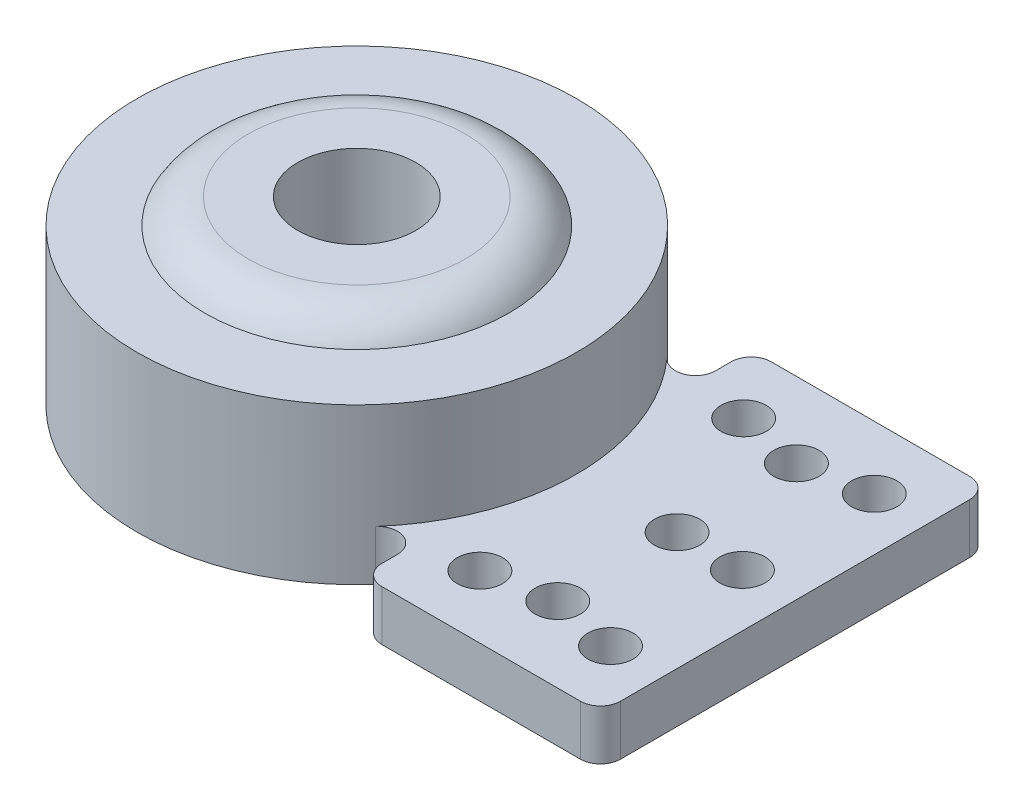
from build123d import *

# Parameters (mm, degrees)
SKETCH1_R           = 8.75
BOSS_EXTRUDE1_DEPTH = 6.2
BOSS_EXTRUDE2_DEPTH = 2
FILLET1_R           = 0.8
SKETCH3_R           = 4.75
BOSS_EXTRUDE3_DEPTH = 1.3
SKETCH6_R           = 6.05
BOSS_EXTRUDE5_DEPTH = 1
SKETCH4_R           = 2.35
CUT_EXTRUDE2_DEPTH  = 22.291195363
FILLET2_R           = 2
SKETCH7_R           = 0.9
CUT_EXTRUDE4_DEPTH  = 10


with BuildPart() as part:
    # Sketch1 → Boss-Extrude1 (new body)
    with BuildSketch(Plane(origin=(0, 0, 0), x_dir=(1, 0, 0), z_dir=(0, 1, 0))):
        with Locations(Location((0, 0, 0), (0, 0, 90))):
            Circle(SKETCH1_R)
    extrude(amount=BOSS_EXTRUDE1_DEPTH)

    # Sketch2 → Boss-Extrude2 (add)
    with BuildSketch(Plane.XZ):
        with BuildLine():
            ThreePointArc((7.95, 3.655133376), (8.547660499, 1.870828693), (8.75, 0))
            Line((8.75, 0), (17.45, 0))
            Line((17.45, 0), (17.45, 7.75))
            Line((17.45, 7.75), (7.95, 7.75))
            Line((7.95, 7.75), (7.95, 3.655133376))
        make_face()
        with BuildLine():
            Line((17.45, 0), (8.75, 0))
            ThreePointArc((8.75, 0), (8.547660499, -1.870828693), (7.95, -3.655133376))
            Line((7.95, -3.655133376), (7.95, -7.75))
            Line((7.95, -7.75), (17.45, -7.75))
            Line((17.45, -7.75), (17.45, 0))
        make_face()
    extrude(amount=-BOSS_EXTRUDE2_DEPTH)

    # Fillet1
    fillet1_edges = [part.edges().sort_by_distance(p)[0] for p in [
        (7.95, 1, 3.655133376),
        (7.95, 1, 7.75),
        (17.45, 1, 7.75),
        (17.45, 1, -7.75),
        (7.95, 1, -7.75),
        (7.95, 1, -3.655133376),
    ]]
    fillet(fillet1_edges, radius=FILLET1_R)

    # Sketch3 → Boss-Extrude3 (add)
    with BuildSketch(Plane.XZ):
        with Locations(Location((0, 0, 0), (0, 0, 270))):
            Circle(SKETCH3_R)
    extrude(amount=BOSS_EXTRUDE3_DEPTH)

    # Sketch6 → Boss-Extrude5 (add)
    with BuildSketch(Plane(origin=(0, 6.2, 0), x_dir=(1, 0, 0), z_dir=(0, 1, 0))):
        with Locations(Location((0, 0, 0), (0, 0, 270))):
            Circle(SKETCH6_R)
    extrude(amount=BOSS_EXTRUDE5_DEPTH)

    # Sketch4 → Cut-Extrude2 (cut, through all)
    with BuildSketch(Plane.XZ.offset(1.3)):
        with Locations(Location((0, 0, 0), (0, 0, 270))):
            Circle(SKETCH4_R)
    extrude(amount=-CUT_EXTRUDE2_DEPTH, mode=Mode.SUBTRACT)

    # Fillet2
    # the kernel refuses this fillet: 2 mm, written as the material it takes off along each edge
    with BuildSketch(Plane(origin=(0, 7.2, 0), x_dir=(0, 0, 1), z_dir=(-1, 0, 0))) as fillet2_piece_1:
        with BuildLine():
            CenterArc((4.317949192, -2), FILLET2_R, 30, 60)
            Line((4.317949192, 0), (4.317949192, 0.04))
            Line((4.317949192, 0.04), (6.05, 0.04))
            Line((6.05, 0.04), (6.09, 0))
            ThreePointArc((6.09, 0), (6.09, -0.5), (6.084641016, -0.98))
            Line((6.084641016, -0.98), (6.05, -1))
        make_face()
    revolve(axis=Axis((0, 7.2, 0), (0, 1, 0)), mode=Mode.SUBTRACT)

    # Sketch7 → Cut-Extrude4 (cut)
    with BuildSketch(Plane.XZ):
        with Locations(Location((15.35, -5.25, 0), (0, 0, 270))):
            Circle(SKETCH7_R)
        with Locations(Location((10.15, -5.25, 0), (0, 0, 270))):
            Circle(SKETCH7_R)
        with Locations(Location((12.75, 4.75, 0), (0, 0, 270))):
            Circle(SKETCH7_R)
        with Locations(Location((12.75, 0, 0), (0, 0, 270))):
            Circle(SKETCH7_R)
        with Locations(Location((12.75, -4.75, 0), (0, 0, 270))):
            Circle(SKETCH7_R)
        with Locations(Location((15.35, 5.25, 0), (0, 0, 270))):
            Circle(SKETCH7_R)
        with Locations(Location((15.35, 0, 0), (0, 0, 270))):
            Circle(SKETCH7_R)
        with Locations(Location((10.15, 5.25, 0), (0, 0, 270))):
            Circle(SKETCH7_R)
    extrude(amount=-CUT_EXTRUDE4_DEPTH, mode=Mode.SUBTRACT)


solid = part.part
